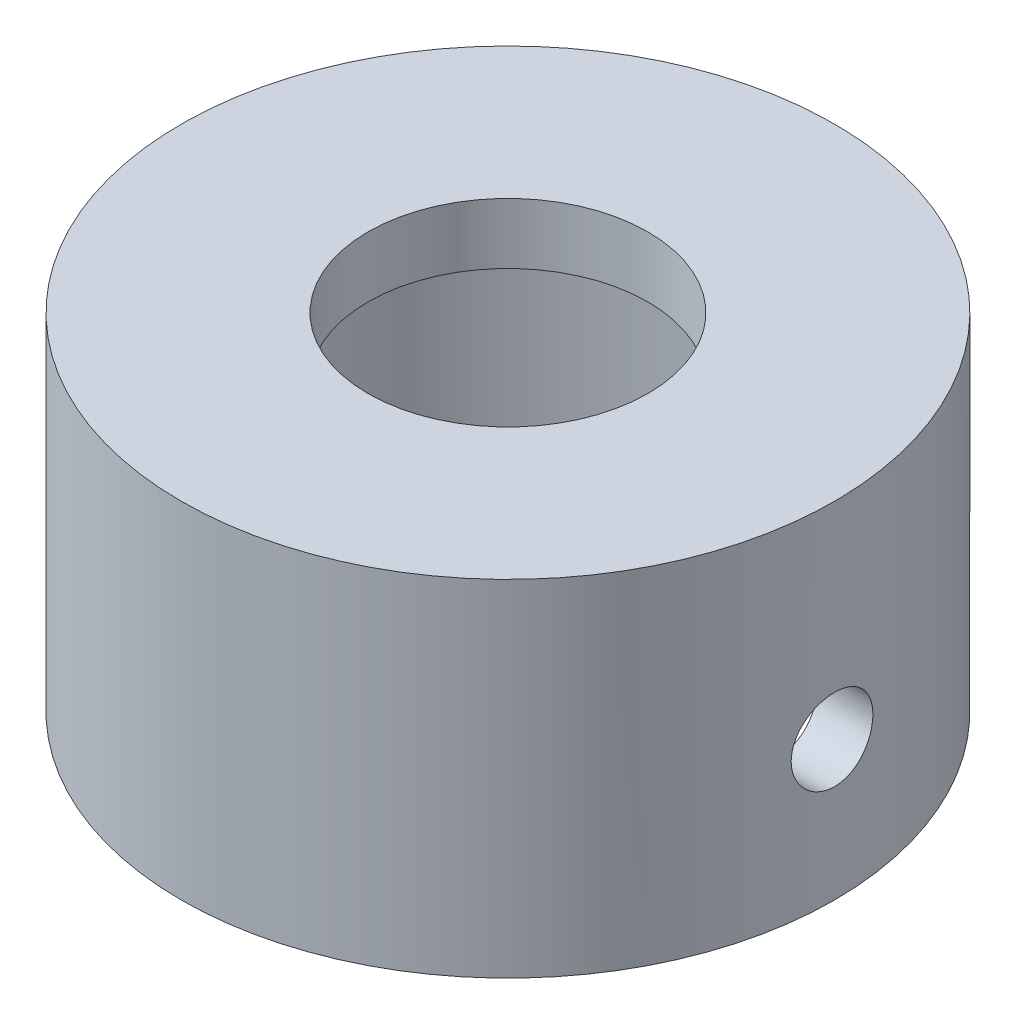
from build123d import *

# Parameters (mm, degrees)
SKETCH1_R               = 22.225
BOSS_EXTRUDE1_DEPTH     = 19.05
SKETCH2_R               = 18.542
CUT_EXTRUDE1_DEPTH      = 13.3985
SKETCH3_R               = 9.525
CUT_EXTRUDE2_DEPTH      = 37.753282166
SKETCH4_R               = 15.875
CUT_EXTRUDE3_DEPTH      = 1.524
CUT_EXTRUDE4_DEPTH      = 37.753282166
CUT_EXTRUDE4_DEPTH_BACK = 37.753282166
SKETCH5_R               = 2.778125
SKETCH6_R               = 22.225
BOSS_EXTRUDE2_DEPTH     = 4.445
SKETCH7_R               = 18.542
CUT_EXTRUDE5_DEPTH      = 6.35


with BuildPart() as part:
    # Sketch1 → Boss-Extrude1 (new body)
    with BuildSketch(Plane(origin=(0, 0, 0), x_dir=(1, 0, 0), z_dir=(0, 1, 0))):
        Circle(SKETCH1_R)
    extrude(amount=-BOSS_EXTRUDE1_DEPTH)

    # Sketch2 → Cut-Extrude1 (cut)
    with BuildSketch(Plane.XZ.offset(19.05)):
        Circle(SKETCH2_R)
    extrude(amount=-CUT_EXTRUDE1_DEPTH, mode=Mode.SUBTRACT)

    # Sketch3 → Cut-Extrude2 (cut, through all)
    with BuildSketch(Plane(origin=(0, 0, 0), x_dir=(1, 0, 0), z_dir=(0, 1, 0))):
        Circle(SKETCH3_R)
    extrude(amount=-CUT_EXTRUDE2_DEPTH, mode=Mode.SUBTRACT)

    # Sketch4 → Cut-Extrude3 (cut)
    with BuildSketch(Plane.XZ.offset(5.6515)):
        Circle(SKETCH4_R)
    extrude(amount=-CUT_EXTRUDE3_DEPTH, mode=Mode.SUBTRACT)

    # Sketch5 → Cut-Extrude4 (cut, two sides: drawn at the far end of the back side and taken through both)
    with BuildSketch(Plane(origin=(0, 0, 0), x_dir=(0, 0, -1), z_dir=(1, 0, 0)).offset(-CUT_EXTRUDE4_DEPTH_BACK)):
        with Locations((0, -14.0335)):
            Circle(SKETCH5_R)
    extrude(amount=CUT_EXTRUDE4_DEPTH + CUT_EXTRUDE4_DEPTH_BACK, mode=Mode.SUBTRACT)

    # Sketch6 → Boss-Extrude2 (add)
    with BuildSketch(Plane.XZ.offset(19.05)):
        Circle(SKETCH6_R)
    extrude(amount=BOSS_EXTRUDE2_DEPTH)

    # Sketch7 → Cut-Extrude5 (cut)
    with BuildSketch(Plane.XZ.offset(23.495)):
        Circle(SKETCH7_R)
    extrude(amount=-CUT_EXTRUDE5_DEPTH, mode=Mode.SUBTRACT)


solid = part.part
